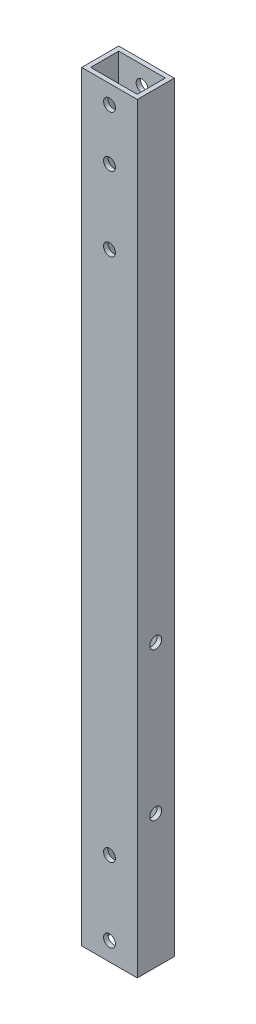
from build123d import *

# Parameters (mm, degrees)
SKETCH_1_W          = 15
SKETCH_1_H          = 10
SKETCH_1_W_2        = 12.6
SKETCH_1_H_2        = 7.6
EXTRUDE_1_DEPTH     = 110
SKETCH_2_R          = 1.6
CUT_EXTRUDE_1_DEPTH = 100
SKETCH_3_R          = 1.6
CUT_EXTRUDE_2_DEPTH = 15
SKETCH_5_W          = 15
SKETCH_5_H          = 10
CUT_EXTRUDE_4_DEPTH = 14.5
SKETCH_6_R          = 1.6
CUT_EXTRUDE_5_DEPTH = 15


with BuildPart() as part:
    # ｽｹｯﾁ1 → ﾎﾞｽ - 押し出し1 (new, symmetric)
    with BuildSketch(Plane(origin=(0, 0, 0), x_dir=(1, 0, 0), z_dir=(0, 1, 0))):
        Rectangle(SKETCH_1_W, SKETCH_1_H)
        Rectangle(SKETCH_1_W_2, SKETCH_1_H_2, mode=Mode.SUBTRACT)
    extrude(amount=EXTRUDE_1_DEPTH, both=True)

    # ｽｹｯﾁ2 → ｶｯﾄ - 押し出し1 (cut)
    with BuildSketch(Plane(origin=(0, 0, -5), x_dir=(-1, 0, 0), z_dir=(0, 0, -1))):
        with Locations((0, -85)):
            Circle(SKETCH_2_R)
        with Locations((0, -105)):
            Circle(SKETCH_2_R)
    extrude(amount=-CUT_EXTRUDE_1_DEPTH, mode=Mode.SUBTRACT)

    # ｽｹｯﾁ3 → ｶｯﾄ - 押し出し2 (cut)
    with BuildSketch(Plane.ZY.offset(7.5)):
        with Locations((0, -74)):
            Circle(SKETCH_3_R)
        with Locations((0, -34)):
            Circle(SKETCH_3_R)
    extrude(amount=-CUT_EXTRUDE_2_DEPTH, mode=Mode.SUBTRACT)

    # ｽｹｯﾁ5 → ｶｯﾄ - 押し出し4 (cut)
    with BuildSketch(Plane(origin=(0, 110, 0), x_dir=(1, 0, 0), z_dir=(0, 1, 0))):
        Rectangle(SKETCH_5_W, SKETCH_5_H)
    extrude(amount=-CUT_EXTRUDE_4_DEPTH, mode=Mode.SUBTRACT)

    # ｽｹｯﾁ6 → ｶｯﾄ - 押し出し5 (cut)
    with BuildSketch(Plane(origin=(0, 0, -5), x_dir=(-1, 0, 0), z_dir=(0, 0, -1))):
        with Locations((0, 90.5)):
            Circle(SKETCH_6_R)
        with Locations((0, 76.66)):
            Circle(SKETCH_6_R)
        with Locations((0, 56.66)):
            Circle(SKETCH_6_R)
    extrude(amount=-CUT_EXTRUDE_5_DEPTH, mode=Mode.SUBTRACT)


solid = part.part
